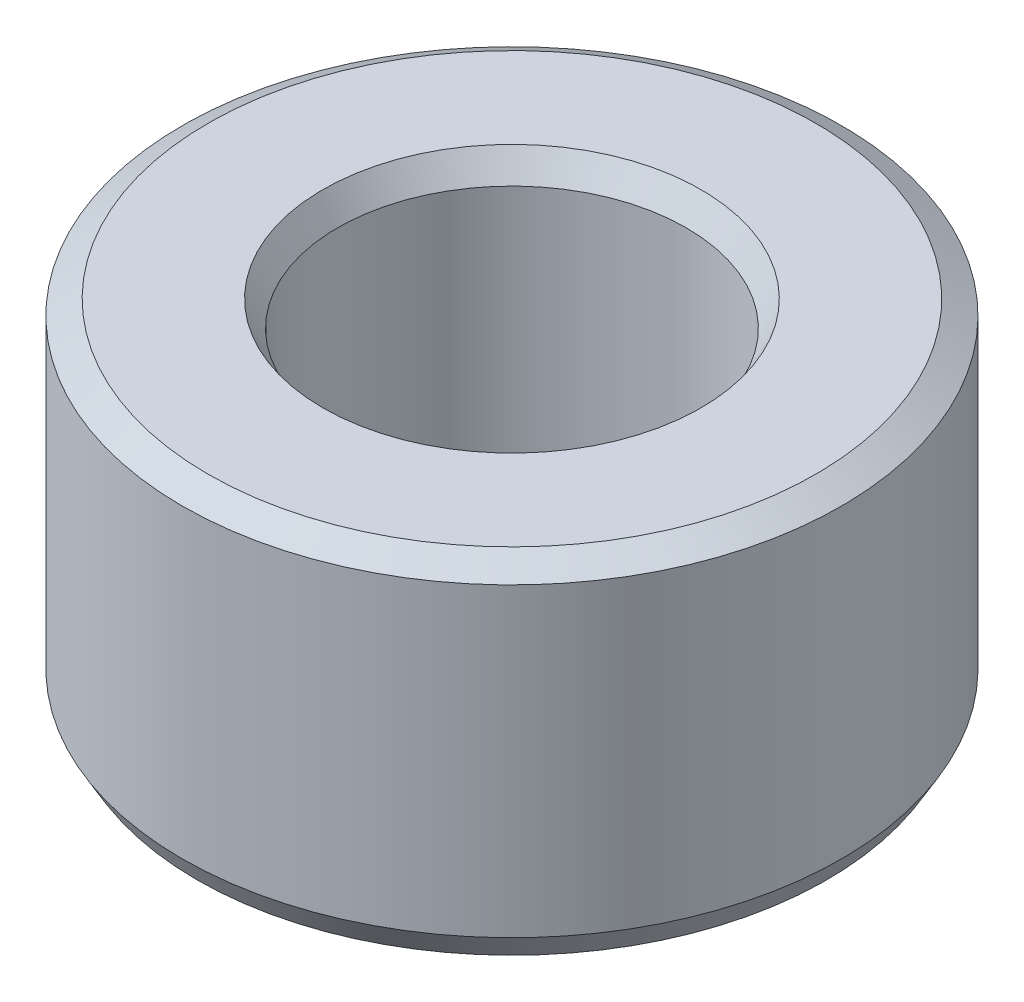
from build123d import *
from OCP.BRepFilletAPI import BRepFilletAPI_MakeChamfer

# Parameters (mm, degrees)
SKETCH1_R           = 42.5
BOSS_EXTRUDE1_DEPTH = 44.618755837
SKETCH2_R           = 22.473556285
CUT_EXTRUDE1_DEPTH  = 75.855416454
CHAMFER1_SIZE       = 1.909522042
CHAMFER1_SIZE2      = 3.307389196


with BuildPart() as part:
    # Sketch1 → Boss-Extrude1 (new body)
    with BuildSketch(Plane(origin=(0, 0, 0), x_dir=(1, 0, 0), z_dir=(0, 1, 0))):
        Circle(SKETCH1_R)
    extrude(amount=BOSS_EXTRUDE1_DEPTH)

    # Sketch2 → Cut-Extrude1 (cut, through all)
    with BuildSketch(Plane(origin=(0, 0, 0), x_dir=(1, 0, 0), z_dir=(0, 1, 0))):
        Circle(SKETCH2_R)
    extrude(amount=CUT_EXTRUDE1_DEPTH, mode=Mode.SUBTRACT)

    # Chamfer1: one chamfer whose edges measure the first distance from different faces: ONE call of the kernel's chamfer builder (chamfer() names one face for all edges)
    chamfer1_edges_1 = [part.edges().sort_by_distance(p)[0] for p in [
        (-22.473556285, 44.618755837, 0),
    ]]
    chamfer1_side_1 = [part.faces().sort_by_distance(p)[0] for p in [
        (-41.297918472, 44.618755837, 0),
    ]]
    chamfer1_edges_2 = [part.edges().sort_by_distance(p)[0] for p in [
        (-22.473556285, 0, 0),
    ]]
    chamfer1_side_2 = [part.faces().sort_by_distance(p)[0] for p in [
        (-22.473556285, 22.309377918, 0),
    ]]
    chamfer1_edges_3 = [part.edges().sort_by_distance(p)[0] for p in [
        (-42.5, 0, 0),
    ]]
    chamfer1_side_3 = [part.faces().sort_by_distance(p)[0] for p in [
        (-41.297918472, 0, 0),
    ]]
    chamfer1_edges_4 = [part.edges().sort_by_distance(p)[0] for p in [
        (-42.5, 44.618755837, 0),
    ]]
    chamfer1_side_4 = [part.faces().sort_by_distance(p)[0] for p in [
        (-42.5, 22.309377918, 0),
    ]]
    chamfer1 = BRepFilletAPI_MakeChamfer(part.part.solid().wrapped)
    for e in chamfer1_edges_1:
        chamfer1.Add(CHAMFER1_SIZE, CHAMFER1_SIZE2, e.wrapped, chamfer1_side_1[0].wrapped)  # the first distance lies on this face
    for e in chamfer1_edges_2:
        chamfer1.Add(CHAMFER1_SIZE, CHAMFER1_SIZE2, e.wrapped, chamfer1_side_2[0].wrapped)  # the first distance lies on this face
    for e in chamfer1_edges_3:
        chamfer1.Add(CHAMFER1_SIZE, CHAMFER1_SIZE2, e.wrapped, chamfer1_side_3[0].wrapped)  # the first distance lies on this face
    for e in chamfer1_edges_4:
        chamfer1.Add(CHAMFER1_SIZE, CHAMFER1_SIZE2, e.wrapped, chamfer1_side_4[0].wrapped)  # the first distance lies on this face
    add(Compound.cast(chamfer1.Shape()), mode=Mode.REPLACE)


solid = part.part
